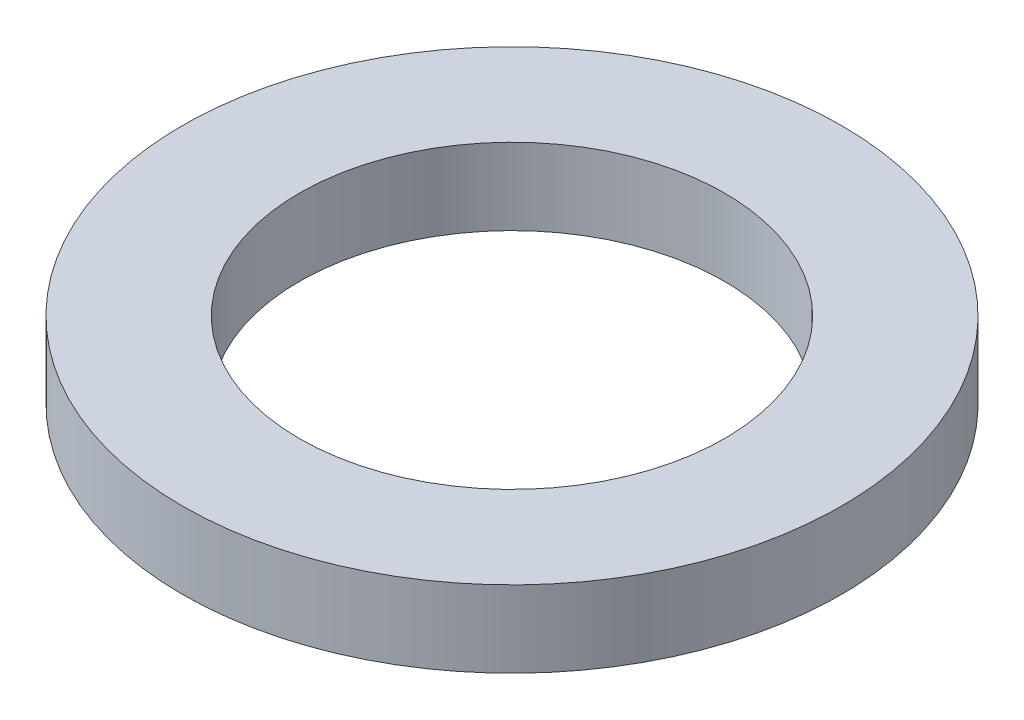
from build123d import *

# Parameters (mm, degrees)
SKETCH1_R           = 77.5
BOSS_EXTRUDE1_DEPTH = 18
SKETCH2_R           = 50
CUT_EXTRUDE1_DEPTH  = 112.069797875


with BuildPart() as part:
    # Sketch1 → Boss-Extrude1 (new body)
    with BuildSketch(Plane(origin=(0, 0, 0), x_dir=(1, 0, 0), z_dir=(0, 1, 0))):
        Circle(SKETCH1_R)
    extrude(amount=BOSS_EXTRUDE1_DEPTH)

    # Sketch2 → Cut-Extrude1 (cut, through all)
    with BuildSketch(Plane(origin=(0, 0, 0), x_dir=(1, 0, 0), z_dir=(0, 1, 0))):
        Circle(SKETCH2_R)
    extrude(amount=CUT_EXTRUDE1_DEPTH, mode=Mode.SUBTRACT)


solid = part.part
